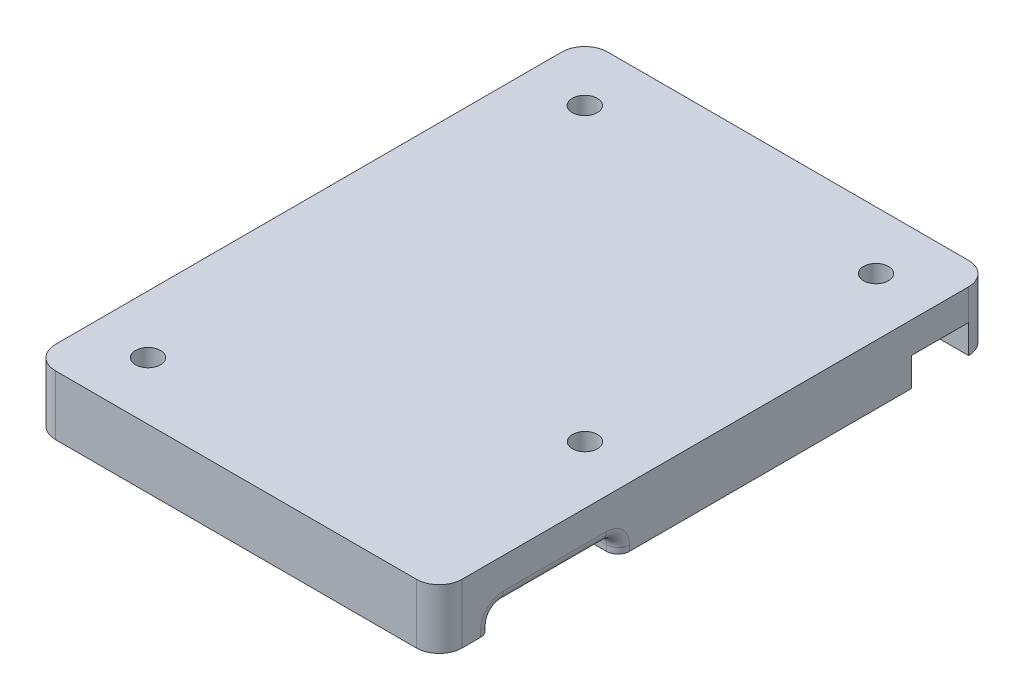
from build123d import *

# Parameters (mm, degrees)
SKETCH1_W           = 35.5
SKETCH1_H           = 48.2
SKETCH1_R           = 1.09
BOSS_EXTRUDE2_DEPTH = 5.2
SKETCH1_4_W         = 31.5
SKETCH1_4_H         = 44.2
CUT_EXTRUDE1_DEPTH  = 1.6
CUT_EXTRUDE2_DEPTH  = 2
SKETCH6_W           = 21.34
SKETCH6_H           = 8.5
CUT_EXTRUDE5_DEPTH  = 1
SKETCH4_W           = 2
SKETCH4_H           = 5
CUT_EXTRUDE3_DEPTH  = 2.5
SKETCH5_W           = 11
SKETCH5_H           = 1.5
CUT_EXTRUDE4_DEPTH  = 2
FILLET1_R           = 2
FILLET3_R           = 2.54
FILLET4_R           = 1
FILLET2_R           = 1


with BuildPart() as part:
    # Sketch1 → Boss-Extrude2 (new body)
    with BuildSketch(Plane(origin=(0, 0, 0), x_dir=(1, 0, 0), z_dir=(0, 1, 0))):
        with Locations((7.932292683, -8.236727254)):
            Rectangle(SKETCH1_W, SKETCH1_H)
        with Locations(Location((20.642292683, 10.823272746, 0), (0, 0, 270))):
            Circle(SKETCH1_R, mode=Mode.SUBTRACT)
        with Locations(Location((-4.777707317, 10.823272746, 0), (0, 0, 270))):
            Circle(SKETCH1_R, mode=Mode.SUBTRACT)
        with Locations(Location((-4.777707317, -27.296727254, 0), (0, 0, 270))):
            Circle(SKETCH1_R, mode=Mode.SUBTRACT)
        with Locations(Location((20.642292683, -14.576727254, 0), (0, 0, 270))):
            Circle(SKETCH1_R, mode=Mode.SUBTRACT)
    extrude(amount=BOSS_EXTRUDE2_DEPTH)

    # Sketch1<4> → Cut-Extrude1 (cut)
    with BuildSketch(Plane(origin=(0, 0, 0), x_dir=(1, 0, 0), z_dir=(0, 1, 0))):
        with Locations((7.932292683, -8.236727254)):
            Rectangle(SKETCH1_4_W, SKETCH1_4_H)
    extrude(amount=CUT_EXTRUDE1_DEPTH, mode=Mode.SUBTRACT)

    # Sketch3 → Cut-Extrude2 (cut)
    with BuildSketch(Plane.XZ.offset(-1.6)):
        Polygon((-2.737707317, -13.863272746), (18.602292683, -13.863272746), (18.602292683, -8.783272746), (23.682292683, -8.783272746), (23.682292683, 12.036727254), (18.602292683, 12.036727254), (18.602292683, 17.116727254), (23.682292683, 17.116727254), (23.682292683, 30.336727254), (-2.737707317, 30.336727254), (-2.737707317, 25.256727254), (-7.817707317, 25.256727254), (-7.817707317, -8.783272746), (-2.737707317, -8.783272746), align=None)
    extrude(amount=-CUT_EXTRUDE2_DEPTH, mode=Mode.SUBTRACT)

    # Sketch6 → Cut-Extrude5 (cut)
    with BuildSketch(Plane.XZ.offset(-3.6)):
        with Locations((7.932292683, -9.613272746)):
            Rectangle(SKETCH6_W, SKETCH6_H)
    extrude(amount=-CUT_EXTRUDE5_DEPTH, mode=Mode.SUBTRACT)

    # Sketch4 → Cut-Extrude3 (cut)
    with BuildSketch(Plane.XZ):
        with Locations((24.682292683, -11.363272746)):
            Rectangle(SKETCH4_W, SKETCH4_H)
        with Locations((-8.817707317, -11.363272746)):
            Rectangle(SKETCH4_W, SKETCH4_H)
    extrude(amount=-CUT_EXTRUDE3_DEPTH, mode=Mode.SUBTRACT)

    # Sketch5 → Cut-Extrude4 (cut)
    with BuildSketch(Plane(origin=(25.682292683, 0, 0), x_dir=(0, 0, -1), z_dir=(1, 0, 0))):
        with Locations((-22.236727254, 0.75)):
            Rectangle(SKETCH5_W, SKETCH5_H)
    extrude(amount=-CUT_EXTRUDE4_DEPTH, mode=Mode.SUBTRACT)

    # Fillet1
    fillet1_edges = [part.edges().sort_by_distance(p)[0] for p in [
        (-9.817707317, 2.6, -15.863272746),
        (25.682292683, 2.6, -15.863272746),
        (25.682292683, 2.6, 32.336727254),
        (-9.817707317, 2.6, 32.336727254),
    ]]
    fillet(fillet1_edges, radius=FILLET1_R - 0.0001)  # a hair under: the kernel refuses the full size

    # Fillet3
    fillet3_edges = [part.edges().sort_by_distance(p)[0] for p in [
        (-2.737707317, 2.6, 25.256727254),
        (18.602292683, 2.6, 17.116727254),
        (18.602292683, 2.6, 12.036727254),
        (18.602292683, 2.6, -8.783272746),
        (-2.737707317, 2.6, -8.783272746),
    ]]
    fillet(fillet3_edges, radius=FILLET3_R - 0.0001)  # a hair under: the kernel refuses the full size

    # Fillet4
    fillet4_edges = [part.edges().sort_by_distance(p)[0] for p in [
        (24.682292683, 1.5, 27.736727254),
        (24.682292683, 1.5, 16.736727254),
    ]]
    fillet(fillet4_edges, radius=FILLET4_R)

    # Fillet2
    fillet2_edges = [part.edges().sort_by_distance(p)[0] for p in [
        (25.682292683, 0.25, 16.736727254),
        (25.682292683, 0.25, 27.736727254),
        (25.682292683, 1.5, 22.236727254),
        (25.682292683, 1.207106781, 27.443834036),
        (25.682292683, 1.207106781, 17.029620473),
    ]]
    fillet(fillet2_edges, radius=FILLET2_R)


solid = part.part
